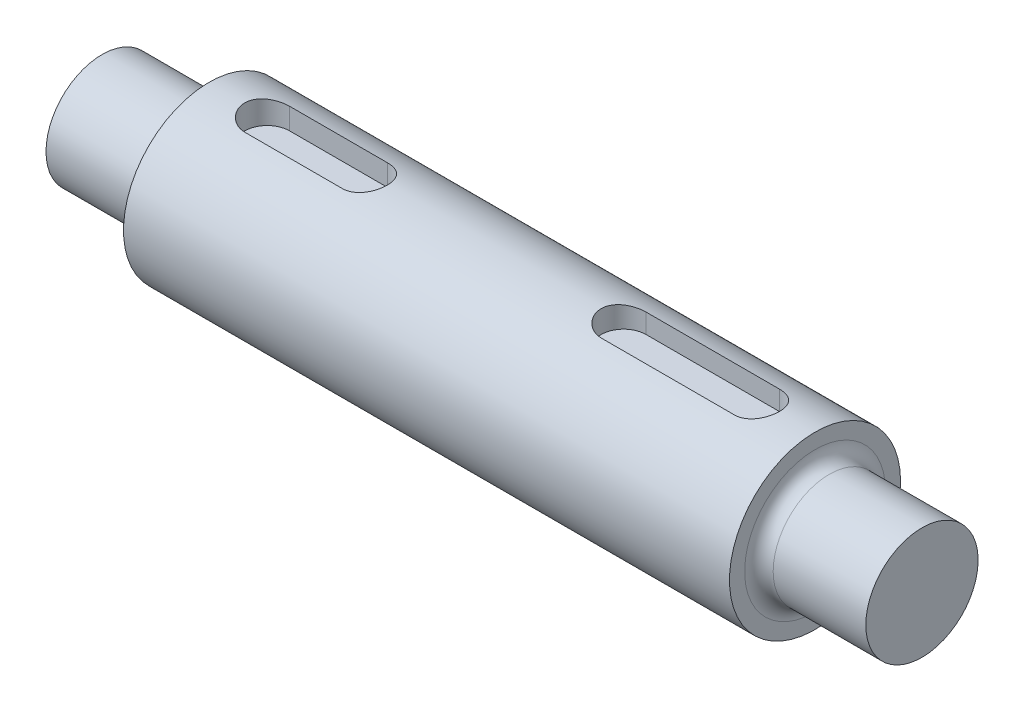
from build123d import *

# Parameters (mm, degrees)
SKETCH1_R                = 20
BOSS_EXTRUDE1_DEPTH      = 38.1
SKETCH2_R                = 30.48
BOSS_EXTRUDE2_DEPTH      = 215.9
SKETCH3_R                = 19.9999981
BOSS_EXTRUDE3_DEPTH      = 38.1
FILLET1_R                = 5.08
SKETCH6_W                = 16.002
SKETCH6_H                = 16.002
CUT_EXTRUDE1_DEPTH       = 50.8
SKETCH7_W                = 16
SKETCH7_H                = 16
CUT_EXTRUDE2_DEPTH       = 63.5
BOSS_EXTRUDE4_REACH      = 300.305
BOSS_EXTRUDE4_END_RADIUS = 30.48
BOSS_EXTRUDE5_REACH      = 300.423
BOSS_EXTRUDE5_END_RADIUS = 30.48


with BuildPart() as part:
    # Sketch1 → Boss-Extrude1 (new body)
    with BuildSketch(Plane(origin=(0, 0, 0), x_dir=(0, 0, -1), z_dir=(1, 0, 0))):
        Circle(SKETCH1_R)
    extrude(amount=BOSS_EXTRUDE1_DEPTH)

    # Sketch2 → Boss-Extrude2 (add)
    with BuildSketch(Plane(origin=(38.1, 0, 0), x_dir=(0, 0, -1), z_dir=(1, 0, 0))):
        Circle(SKETCH2_R)
    extrude(amount=BOSS_EXTRUDE2_DEPTH)

    # Sketch3 → Boss-Extrude3 (add)
    with BuildSketch(Plane(origin=(254, 0, 0), x_dir=(0, 0, -1), z_dir=(1, 0, 0))):
        Circle(SKETCH3_R)
    extrude(amount=BOSS_EXTRUDE3_DEPTH)

    # Fillet1
    fillet1_edges = [part.edges().sort_by_distance(p)[0] for p in [
        (254, 0, 19.9999981),
        (38.1, 0, 20),
    ]]
    fillet(fillet1_edges, radius=FILLET1_R)

    # Sketch6 → Cut-Extrude1 (cut)
    with BuildSketch(Plane(origin=(50.8, 0, 0), x_dir=(0, 0, -1), z_dir=(1, 0, 0))):
        with Locations((0, 29.812996)):
            Rectangle(SKETCH6_W, SKETCH6_H)
    extrude(amount=CUT_EXTRUDE1_DEPTH, mode=Mode.SUBTRACT)

    # Sketch7 → Cut-Extrude2 (cut)
    with BuildSketch(Plane.ZY.offset(-177.8)):
        with Locations((0, 30.48)):
            Rectangle(SKETCH7_W, SKETCH7_H)
    extrude(amount=-CUT_EXTRUDE2_DEPTH, mode=Mode.SUBTRACT)

    # Boss-Extrude4: up to this cylinder (the profile starts inside it)
    boss_extrude4_end = Plane(origin=(76.2, 0, 0), z_dir=(-1, 0, 0)) * Cylinder(BOSS_EXTRUDE4_END_RADIUS, 709.795666, mode=Mode.PRIVATE)
    # Sketch8 → Boss-Extrude4 (add, up to the surface)
    with BuildSketch(Plane(origin=(0, 21.811996, 0), x_dir=(1, 0, 0), z_dir=(0, 1, 0)), mode=Mode.PRIVATE) as boss_extrude4_sk1:
        with BuildLine():
            Line((58.801, 8.001), (50.8, 8.001))
            Line((50.8, 8.001), (50.8, 0))
            ThreePointArc((50.8, 0), (53.143438644, 5.657561356), (58.801, 8.001))
        make_face()
    boss_extrude4_tool1 = extrude(boss_extrude4_sk1.sketch, amount=BOSS_EXTRUDE4_REACH, mode=Mode.PRIVATE) & boss_extrude4_end
    add(boss_extrude4_tool1.solids().sort_by_distance((52.587167, 21.811996, -6.213833))[0])
    # Sketch8 → Boss-Extrude4 (add, up to the surface)
    with BuildSketch(Plane(origin=(0, 21.811996, 0), x_dir=(1, 0, 0), z_dir=(0, 1, 0)), mode=Mode.PRIVATE) as boss_extrude4_sk2:
        with BuildLine():
            ThreePointArc((58.801, -8.001), (53.143438644, -5.657561356), (50.8, 0))
            Line((50.8, 0), (50.8, -8.001))
            Line((50.8, -8.001), (58.801, -8.001))
        make_face()
    boss_extrude4_tool2 = extrude(boss_extrude4_sk2.sketch, amount=BOSS_EXTRUDE4_REACH, mode=Mode.PRIVATE) & boss_extrude4_end
    add(boss_extrude4_tool2.solids().sort_by_distance((52.587167, 21.811996, 6.213833))[0])
    # Sketch8 → Boss-Extrude4 (add, up to the surface)
    with BuildSketch(Plane(origin=(0, 21.811996, 0), x_dir=(1, 0, 0), z_dir=(0, 1, 0)), mode=Mode.PRIVATE) as boss_extrude4_sk3:
        with BuildLine():
            Line((101.6, 8.001), (93.599, 8.001))
            ThreePointArc((93.599, 8.001), (99.256561356, 5.657561356), (101.6, 0))
            Line((101.6, 0), (101.6, 8.001))
        make_face()
    boss_extrude4_tool3 = extrude(boss_extrude4_sk3.sketch, amount=BOSS_EXTRUDE4_REACH, mode=Mode.PRIVATE) & boss_extrude4_end
    add(boss_extrude4_tool3.solids().sort_by_distance((99.812833, 21.811996, -6.213833))[0])
    # Sketch8 → Boss-Extrude4 (add, up to the surface)
    with BuildSketch(Plane(origin=(0, 21.811996, 0), x_dir=(1, 0, 0), z_dir=(0, 1, 0)), mode=Mode.PRIVATE) as boss_extrude4_sk4:
        with BuildLine():
            ThreePointArc((101.6, 0), (99.256561356, -5.657561356), (93.599, -8.001))
            Line((93.599, -8.001), (101.6, -8.001))
            Line((101.6, -8.001), (101.6, 0))
        make_face()
    boss_extrude4_tool4 = extrude(boss_extrude4_sk4.sketch, amount=BOSS_EXTRUDE4_REACH, mode=Mode.PRIVATE) & boss_extrude4_end
    add(boss_extrude4_tool4.solids().sort_by_distance((99.812833, 21.811996, 6.213833))[0])

    # Boss-Extrude5: up to this cylinder (the profile starts inside it)
    boss_extrude5_end = Plane(origin=(209.55, 0, 0), z_dir=(-1, 0, 0)) * Cylinder(BOSS_EXTRUDE5_END_RADIUS, 722.732112, mode=Mode.PRIVATE)
    # Sketch10 → Boss-Extrude5 (add, up to the surface)
    with BuildSketch(Plane(origin=(0, 22.48, 0), x_dir=(1, 0, 0), z_dir=(0, 1, 0)), mode=Mode.PRIVATE) as boss_extrude5_sk1:
        with BuildLine():
            ThreePointArc((177.8, 0), (180.143145751, 5.656854249), (185.8, 8))
            Line((185.8, 8), (177.8, 8))
            Line((177.8, 8), (177.8, 0))
        make_face()
    boss_extrude5_tool1 = extrude(boss_extrude5_sk1.sketch, amount=BOSS_EXTRUDE5_REACH, mode=Mode.PRIVATE) & boss_extrude5_end
    add(boss_extrude5_tool1.solids().sort_by_distance((179.586944, 22.48, -6.213056))[0])
    # Sketch10 → Boss-Extrude5 (add, up to the surface)
    with BuildSketch(Plane(origin=(0, 22.48, 0), x_dir=(1, 0, 0), z_dir=(0, 1, 0)), mode=Mode.PRIVATE) as boss_extrude5_sk2:
        with BuildLine():
            Line((241.3, 8), (233.3, 8))
            ThreePointArc((233.3, 8), (238.956854249, 5.656854249), (241.3, 0))
            Line((241.3, 0), (241.3, 8))
        make_face()
    boss_extrude5_tool2 = extrude(boss_extrude5_sk2.sketch, amount=BOSS_EXTRUDE5_REACH, mode=Mode.PRIVATE) & boss_extrude5_end
    add(boss_extrude5_tool2.solids().sort_by_distance((239.513056, 22.48, -6.213056))[0])
    # Sketch10 → Boss-Extrude5 (add, up to the surface)
    with BuildSketch(Plane(origin=(0, 22.48, 0), x_dir=(1, 0, 0), z_dir=(0, 1, 0)), mode=Mode.PRIVATE) as boss_extrude5_sk3:
        with BuildLine():
            ThreePointArc((185.8, -8), (180.143145751, -5.656854249), (177.8, 0))
            Line((177.8, 0), (177.8, -8))
            Line((177.8, -8), (185.8, -8))
        make_face()
    boss_extrude5_tool3 = extrude(boss_extrude5_sk3.sketch, amount=BOSS_EXTRUDE5_REACH, mode=Mode.PRIVATE) & boss_extrude5_end
    add(boss_extrude5_tool3.solids().sort_by_distance((179.586944, 22.48, 6.213056))[0])
    # Sketch10 → Boss-Extrude5 (add, up to the surface)
    with BuildSketch(Plane(origin=(0, 22.48, 0), x_dir=(1, 0, 0), z_dir=(0, 1, 0)), mode=Mode.PRIVATE) as boss_extrude5_sk4:
        with BuildLine():
            Line((241.3, -8), (241.3, 0))
            ThreePointArc((241.3, 0), (238.956854249, -5.656854249), (233.3, -8))
            Line((233.3, -8), (241.3, -8))
        make_face()
    boss_extrude5_tool4 = extrude(boss_extrude5_sk4.sketch, amount=BOSS_EXTRUDE5_REACH, mode=Mode.PRIVATE) & boss_extrude5_end
    add(boss_extrude5_tool4.solids().sort_by_distance((239.513056, 22.48, 6.213056))[0])


solid = part.part
